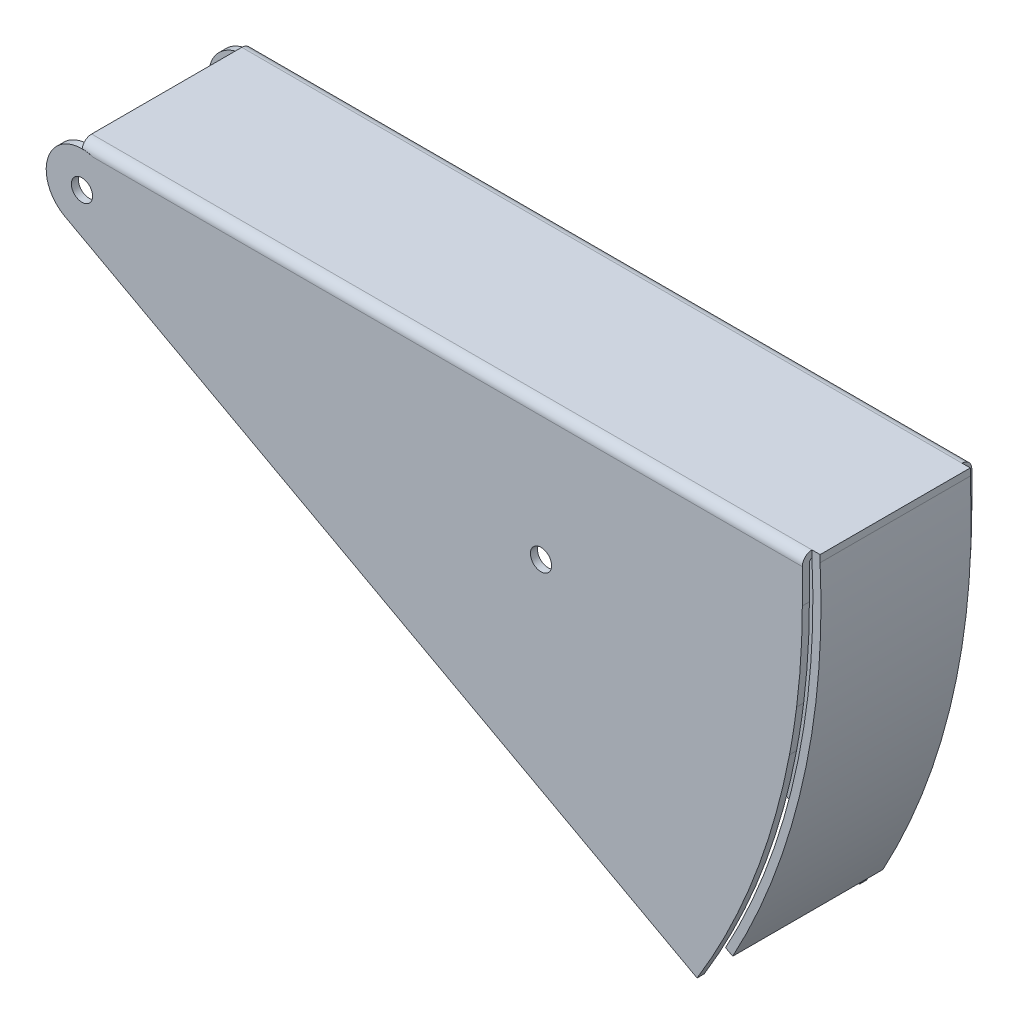
from build123d import *

# Parameters (mm, degrees)
BASE_FLANGE1_DEPTH           = 2
EDGE_FLANGE1_STRIP_CUT_DEPTH = 140
EDGE_FLANGE1_DEPTH           = 140
EDGE_FLANGE2_STRIP_CUT_DEPTH = 140
EDGE_FLANGE2_DEPTH           = 140
BOSS_EXTRUDE1_DEPTH          = 2
BOSS_EXTRUDE2_START          = -2
BOSS_EXTRUDE2_DEPTH          = 2
SKETCH14_R                   = 10.1317
BOSS_EXTRUDE3_DEPTH          = 2
BOSS_EXTRUDE4_START          = -2
SKETCH15_R                   = 10.131700000000007
BOSS_EXTRUDE4_DEPTH          = 2
FILLET1_R                    = 20
SKETCH16_R                   = 3.0000000000000084
SKETCH16_R_2                 = 3.000000000000008
CUT_EXTRUDE1_DEPTH           = 116.00000000000001
BOSS_EXTRUDE5_DEPTH          = 2
BOSS_EXTRUDE6_DEPTH          = 64
BOSS_EXTRUDE8_START          = 64
BOSS_EXTRUDE8_DEPTH          = 64
SKETCH38_R                   = 3.000000000000008
SKETCH38_R_2                 = 2.9999999999999947
BOSS_EXTRUDE9_DEPTH          = 2
BOSS_EXTRUDE10_START         = -2
SKETCH40_R                   = 3.0000000000000084
BOSS_EXTRUDE10_DEPTH         = 2
CUT_EXTRUDE2_START           = -90
CUT_EXTRUDE2_DEPTH           = 90
SKETCH42_W                   = 17.233890077557817
SKETCH42_H                   = 15.447994732733191
CUT_EXTRUDE3_DEPTH           = 90
BOSS_EXTRUDE11_DEPTH         = 42.5268


# Sheet-metal steps are written as plain solids
with BuildPart() as part:
    # Sketch1 → Base-Flange1 (new body)
    with BuildSketch(Plane(origin=(0, 0, 0), x_dir=(1, 0, 0), z_dir=(0, 1, 0))):
        Polygon((69.99999999999999, 24.000000000000007), (-70.00000000000003, 23.99999999999999), (-70.00000000000003, -24.000000000000018), (69.99999999999999, -24), align=None)
    extrude(amount=-BASE_FLANGE1_DEPTH)

    # Edge-Flange1 strip (across the edge) → Edge-Flange1 strip cut (cut)
    with BuildSketch(Plane(origin=(69.99999999999999, -2, 24), x_dir=(-1.2e-16, -3.49e-15, -1), z_dir=(-1, 0, 1.2e-16))):
        Polygon((-6.736600000000024, -2.0000000000000235), (2.73660000000001, -1.9999999999999907), (2.736600000000003, 9.55e-15), (-6.736600000000031, -2.353e-14), align=None)
    extrude(amount=EDGE_FLANGE1_STRIP_CUT_DEPTH, mode=Mode.SUBTRACT)

    # Edge-Flange1 section (across the edge) → Edge-Flange1 (add)
    with BuildSketch(Plane(origin=(69.99999999999999, -2, 24), x_dir=(-1.2e-16, -3.49e-15, -1), z_dir=(-1, 0, 1.2e-16))):
        with BuildLine():
            Line((0, 0.7366000000000096), (0, 20.000000000000004))
            Line((0, 20.000000000000004), (2, 20.000000000000004))
            Line((2, 20.000000000000004), (2, 0.7366000000000096))
            ThreePointArc((2, 0.7366000000000096), (2.21574514497799, 0.21574514497799768), (2.736600000000003, 9.55e-15))
            Line((2.736600000000003, 9.55e-15), (2.73660000000001, -1.9999999999999907))
            ThreePointArc((2.73660000000001, -1.9999999999999907), (0.8015315826048977, -1.1984684173951), (0, 0.7366000000000096))
        make_face()
    extrude(amount=EDGE_FLANGE1_DEPTH)

    # Edge-Flange2 strip (across the edge) → Edge-Flange2 strip cut (cut)
    with BuildSketch(Plane(origin=(-70.00000000000003, -2, -23.999999999999993), x_dir=(1.2e-16, -3.49e-15, 1), z_dir=(1, 0, -1.2e-16))):
        Polygon((-6.736600000000024, -2.0000000000000235), (2.73660000000001, -1.9999999999999907), (2.736600000000003, 9.55e-15), (-6.736600000000031, -2.353e-14), align=None)
    extrude(amount=EDGE_FLANGE2_STRIP_CUT_DEPTH, mode=Mode.SUBTRACT)

    # Edge-Flange2 section (across the edge) → Edge-Flange2 (add)
    with BuildSketch(Plane(origin=(-70.00000000000003, -2, -23.999999999999993), x_dir=(1.2e-16, -3.49e-15, 1), z_dir=(1, 0, -1.2e-16))):
        with BuildLine():
            Line((0, 0.7366000000000096), (0, 20.000000000000004))
            Line((0, 20.000000000000004), (2, 20.000000000000004))
            Line((2, 20.000000000000004), (2, 0.7366000000000096))
            ThreePointArc((2, 0.7366000000000096), (2.21574514497799, 0.21574514497799768), (2.736600000000003, 9.55e-15))
            Line((2.736600000000003, 9.55e-15), (2.73660000000001, -1.9999999999999907))
            ThreePointArc((2.73660000000001, -1.9999999999999907), (0.8015315826048977, -1.1984684173951), (0, 0.7366000000000096))
        make_face()
    extrude(amount=EDGE_FLANGE2_DEPTH)

    # Sketch12 → Boss-Extrude1 (add)
    with BuildSketch(Plane.XY.offset(24)):
        with BuildLine():
            Line((69.99999999999997, -38.00000000000009), (69.99999999999997, -5.0936152776594525))
            Line((69.99999999999997, -5.0936152776594525), (49.99999999999997, -5.093615277659455))
            Line((49.99999999999997, -5.093615277659455), (49.99999999999997, -38.00000000000009))
            ThreePointArc((49.99999999999997, -38.00000000000009), (59.99999999999997, -48.000000000000085), (69.99999999999997, -38.00000000000009))
        make_face()
    extrude(amount=-BOSS_EXTRUDE1_DEPTH)

    # Sketch13 → Boss-Extrude2 (add)
    with BuildSketch(Plane(origin=(-2.97e-15, 8.743e-14, -23.999999999999986), x_dir=(-1, 0, 1.2e-16), z_dir=(-1.2e-16, 3.63e-15, -1)).offset(BOSS_EXTRUDE2_START)):
        with BuildLine():
            Line((-49.99999999999997, -21.999999999999922), (-49.99999999999997, -2.736599999999933))
            Line((-49.99999999999997, -2.736599999999933), (-69.99999999999999, -2.7365999999999113))
            Line((-69.99999999999999, -2.7365999999999113), (-69.99999999999997, -37.99999999999992))
            ThreePointArc((-69.99999999999997, -37.99999999999992), (-59.99999999999997, -47.999999999999915), (-49.99999999999997, -37.999999999999915))
            Line((-49.99999999999997, -37.999999999999915), (-49.99999999999997, -21.999999999999922))
        make_face()
    extrude(amount=BOSS_EXTRUDE2_DEPTH)

    # Sketch14 → Boss-Extrude3 (add)
    with BuildSketch(Plane.XY.offset(24)):
        with Locations((-70.00000000000003, -12.368300000000078)):
            Circle(SKETCH14_R)
    extrude(amount=-BOSS_EXTRUDE3_DEPTH)

    # Sketch15 → Boss-Extrude4 (add)
    with BuildSketch(Plane(origin=(-2.97e-15, 8.743e-14, -23.999999999999986), x_dir=(-1, 0, 1.2e-16), z_dir=(-1.2e-16, 3.63e-15, -1)).offset(BOSS_EXTRUDE4_START)):
        with Locations((70.00000000000003, -12.368300000000081)):
            Circle(SKETCH15_R)
    extrude(amount=BOSS_EXTRUDE4_DEPTH)

    # Fillet1
    fillet1_edges = [part.edges().sort_by_distance(p)[0] for p in [
        (49.99999999999997, -22.000000000000007, -23.000000000000075),
        (49.99999999999997, -22.000000000000007, 23.000000000000036),
    ]]
    fillet(fillet1_edges, radius=FILLET1_R)

    # Sketch16 → Cut-Extrude1 (cut)
    with BuildSketch(Plane.XY.offset(24)):
        with Locations(Location((59.99999999999997, -38.000000000000085, 0), (0, 0, 270))):
            Circle(SKETCH16_R)
        with Locations(Location((-70.00000000000003, -12.368300000000078, 0), (0, 0, 270))):
            Circle(SKETCH16_R_2)
    extrude(amount=-CUT_EXTRUDE1_DEPTH, mode=Mode.SUBTRACT)

    # Sketch23 → Boss-Extrude5 (add)
    with BuildSketch(Plane(origin=(0, 0, 0), x_dir=(1, 0, 0), z_dir=(0, 1, 0))):
        Polygon((69.99999999999999, 21.263400000000036), (149.99999999999997, 21.263400000000036), (149.99999999999997, -17.83002853781927), (149.99999999999997, -21.2634), (69.99999999999999, -21.2634), align=None)
    extrude(amount=-BOSS_EXTRUDE5_DEPTH)

    # Sketch31 → Boss-Extrude6 (add)
    with BuildSketch(Plane(origin=(69.99999999999999, 0, 0), x_dir=(0, 0, -1), z_dir=(1, 0, 0))):
        with BuildLine():
            Line((21.999999999999993, -2.736599999999998), (22.00000000000014, -37.99999999999992))
            Line((22.00000000000014, -37.99999999999992), (24.00000000000013, -37.99999999999983))
            Line((24.00000000000013, -37.99999999999983), (24, -2.736599999999978))
            ThreePointArc((24, -2.736599999999978), (23.198468417395112, -0.8015315826048983), (21.263400000000036, 0))
            Line((21.263400000000036, 0), (21.263400000000008, -2.000000000000007))
            ThreePointArc((21.263400000000008, -2.000000000000007), (21.78425485502201, -2.2157451449779955), (21.999999999999993, -2.736599999999998))
        make_face()
    extrude(amount=BOSS_EXTRUDE6_DEPTH)

    # Sketch37 → Boss-Extrude8 (add)
    with BuildSketch(Plane(origin=(69.99999999999999, 0, -8.67e-15), x_dir=(-1.2e-16, 0, -1), z_dir=(1, 0, -1.2e-16)).offset(BOSS_EXTRUDE8_START)):
        with BuildLine():
            Line((-24.000000000000007, -2.736599999999984), (-24.000000000000007, -38.00000000000001))
            Line((-24.000000000000007, -38.00000000000001), (-22.00000000000013, -38.00000000000001))
            Line((-22.00000000000013, -38.00000000000001), (-22.000000000000007, -2.736599999999991))
            ThreePointArc((-22.000000000000007, -2.736599999999991), (-21.784254855022017, -2.215745144977985), (-21.263400000000008, -2.0000000000000018))
            Line((-21.263400000000008, -2.0000000000000018), (-21.263400000000008, 0))
            ThreePointArc((-21.263400000000008, 0), (-23.198468417395112, -0.8015315826048868), (-24.000000000000007, -2.736599999999984))
        make_face()
    extrude(amount=-BOSS_EXTRUDE8_DEPTH)

    # Sketch38 → Boss-Extrude9 (add)
    with BuildSketch(Plane.XY.offset(24)):
        with BuildLine():
            ThreePointArc((-70.00000000000003, -2.2366000000000525), (-79.81974909015226, -9.873530933241609), (-74.83591228983121, -21.271406043121214))
            Line((-74.83591228983121, -21.271406043121214), (104.20534041751986, -118.52148822351042))
            ThreePointArc((104.20534041751986, -118.52148822351043), (127.65743204047538, -62.8414568179052), (133.77238644648855, -2.7342706299537234))
            Line((133.77238644648853, -2.734270629953711), (-69.95051125882394, -2.236720865704318))
            Line((-69.95051125882394, -2.236720865704318), (-70.00000000000003, -2.2366000000000574))
        make_face()
        with Locations((-70.00000000000003, -12.368300000000078)):
            Circle(SKETCH38_R, mode=Mode.SUBTRACT)
        with Locations((59.99999999999997, -38.000000000000085)):
            Circle(SKETCH38_R_2, mode=Mode.SUBTRACT)
    extrude(amount=-BOSS_EXTRUDE9_DEPTH)

    # Sketch40 → Boss-Extrude10 (add)
    with BuildSketch(Plane(origin=(-2.97e-15, 8.743e-14, -23.999999999999986), x_dir=(-1, 0, 1.2e-16), z_dir=(-1.2e-16, 3.64e-15, -1)).offset(BOSS_EXTRUDE10_START)):
        with BuildLine():
            Line((-133.99999999999997, -37.99999999999992), (-132.38333912432114, -37.99999999999992))
            ThreePointArc((-132.38333912432114, -37.99999999999992), (-122.55047625544603, -79.7501528522397), (-104.20534041751992, -118.52148822351012))
            Line((-104.20534041751992, -118.52148822351012), (74.83591228983121, -21.27140604312103))
            ThreePointArc((74.83591228983121, -21.27140604312103), (79.81974909015223, -9.873530933241451), (70.00000000000003, -2.236599999999915))
            Line((70.00000000000003, -2.236599999999915), (70.00000000000003, -2.7365999999999118))
            Line((70.00000000000003, -2.7365999999999118), (-133.99999999999997, -2.7365999999999118))
            Line((-133.99999999999997, -2.7365999999999118), (-133.99999999999997, -37.99999999999992))
        make_face()
        with Locations(Location((-59.99999999999997, -37.999999999999915, 0), (0, 0, 270))):
            Circle(SKETCH40_R, mode=Mode.SUBTRACT)
        with Locations(Location((70.00000000000003, -12.368300000000081, 0), (0, 0, 270))):
            Circle(SKETCH40_R, mode=Mode.SUBTRACT)
    extrude(amount=BOSS_EXTRUDE10_DEPTH)

    # Sketch41 → Cut-Extrude2 (cut)
    with BuildSketch(Plane(origin=(-2.97e-15, 8.743e-14, -23.999999999999986), x_dir=(-1, 0, 1.2e-16), z_dir=(-1.2e-16, 3.64e-15, -1)).offset(CUT_EXTRUDE2_START)):
        with BuildLine():
            Line((-133.99999999999991, -12.368300000000081), (-149.94232536885565, -45.23983757324427))
            Line((-149.94232536885565, -45.23983757324427), (-130.36666577541695, -50.69843495987621))
            ThreePointArc((-130.36666577541695, -50.69843495987621), (-133.08963515918902, -31.619276362446172), (-133.99999999999991, -12.368300000000081))
        make_face()
    extrude(amount=CUT_EXTRUDE2_DEPTH, mode=Mode.SUBTRACT)

    # Sketch42 → Cut-Extrude3 (cut)
    with BuildSketch(Plane(origin=(0, 0, -21.263400000000036), x_dir=(-1, 0, 0), z_dir=(0, 0, -1))):
        with Locations((-144.91808666667805, -5.115479942404007)):
            Rectangle(SKETCH42_W, SKETCH42_H)
    extrude(amount=-CUT_EXTRUDE3_DEPTH, mode=Mode.SUBTRACT)

    # Sketch43 → Boss-Extrude11 (add)
    with BuildSketch(Plane(origin=(0, 0, -21.263400000000036), x_dir=(-1, 0, 0), z_dir=(0, 0, -1))):
        with BuildLine():
            Line((-109.53531100208852, -109.78787579600389), (-111.55529945125834, -110.88396333851894))
            ThreePointArc((-111.55529945125834, -110.88396333851894), (-131.48462736674514, -57.8832164203161), (-136.27341292027893, -1.4622556169704357))
            Line((-136.27341292027893, -1.4622556169704357), (-133.93880439229082, -0.8589252153757276))
            ThreePointArc((-133.93880439229082, -0.8589252153757276), (-129.32254855641568, -57.02278781326821), (-109.53531100208852, -109.78787579600389))
        make_face()
    extrude(amount=-BOSS_EXTRUDE11_DEPTH)


solid = part.part
